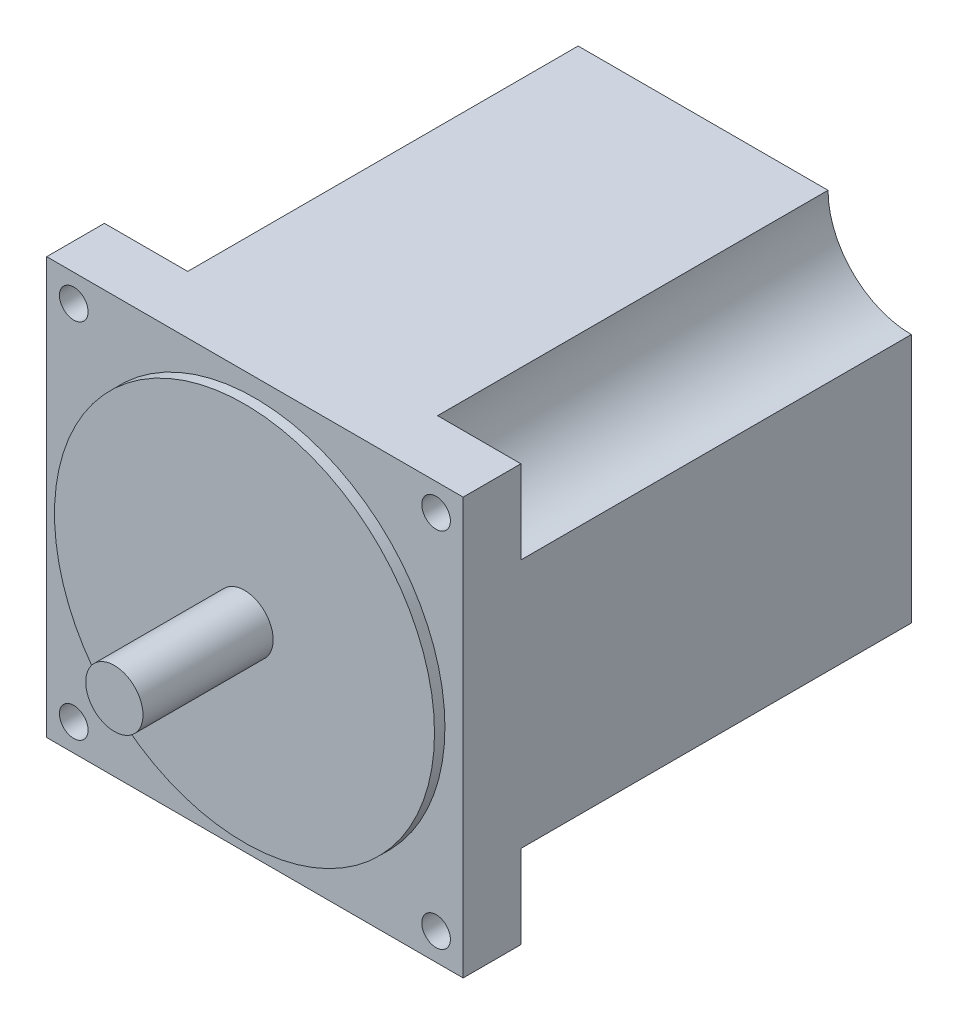
from build123d import *

# Parameters (mm, degrees)
SKETCH2_W           = 80
SKETCH2_H           = 80
BOSS_EXTRUDE1_DEPTH = 86.09
SKETCH3_R           = 2.75
CUT_EXTRUDE1_DEPTH  = 104.012077447
SKETCH4_R           = 36.5
BOSS_EXTRUDE2_DEPTH = 2
SKETCH5_R           = 5.5
BOSS_EXTRUDE3_DEPTH = 25
CUT_EXTRUDE2_START  = -75
SKETCH6_R           = 2.75
CUT_EXTRUDE2_DEPTH  = 75
SKETCH7_R           = 4.006
BOSS_EXTRUDE4_DEPTH = 13.5


with BuildPart() as part:
    # Sketch2 → Boss-Extrude1 (new body)
    with BuildSketch(Plane.XY):
        Rectangle(SKETCH2_W, SKETCH2_H)
    extrude(amount=BOSS_EXTRUDE1_DEPTH)

    # Sketch3 → Cut-Extrude1 (cut, through all)
    with BuildSketch(Plane.XY.offset(86.09)):
        with Locations((-34.8, 34.8)):
            Circle(SKETCH3_R)
        with Locations((34.8, 34.8)):
            Circle(SKETCH3_R)
        with Locations((-34.8, -34.8)):
            Circle(SKETCH3_R)
        with Locations((34.8, -34.8)):
            Circle(SKETCH3_R)
    extrude(amount=-CUT_EXTRUDE1_DEPTH, mode=Mode.SUBTRACT)

    # Sketch4 → Boss-Extrude2 (add)
    with BuildSketch(Plane.XY.offset(86.09)):
        Circle(SKETCH4_R)
    extrude(amount=BOSS_EXTRUDE2_DEPTH)

    # Sketch5 → Boss-Extrude3 (add)
    with BuildSketch(Plane.XY.offset(88.09)):
        Circle(SKETCH5_R)
    extrude(amount=BOSS_EXTRUDE3_DEPTH)

    # Sketch6 → Cut-Extrude2 (cut)
    # profile 1 of 4: a face of its own
    with BuildSketch(Plane(origin=(0, 0, 0), x_dir=(-1, 0, 0), z_dir=(0, 0, -1)).offset(CUT_EXTRUDE2_START)):
        with BuildLine():
            Line((24, -40), (40, -40))
            Line((40, -40), (40, -24))
            ThreePointArc((40, -24), (28.686291501, -28.686291501), (24, -40))
        make_face()
        with Locations((34.8, -34.8)):
            Circle(SKETCH6_R, mode=Mode.SUBTRACT)
    # profile 2 of 4: a face of its own
    with BuildSketch(Plane(origin=(0, 0, 0), x_dir=(-1, 0, 0), z_dir=(0, 0, -1)).offset(CUT_EXTRUDE2_START)):
        with BuildLine():
            Line((-40, -40), (-24, -40))
            ThreePointArc((-24, -40), (-28.686291501, -28.686291501), (-40, -24))
            Line((-40, -24), (-40, -40))
        make_face()
        with Locations((-34.8, -34.8)):
            Circle(SKETCH6_R, mode=Mode.SUBTRACT)
    # profile 3 of 4: a face of its own
    with BuildSketch(Plane(origin=(0, 0, 0), x_dir=(-1, 0, 0), z_dir=(0, 0, -1)).offset(CUT_EXTRUDE2_START)):
        with BuildLine():
            ThreePointArc((24, 40), (28.686291501, 28.686291501), (40, 24))
            Line((40, 24), (40, 40))
            Line((40, 40), (24, 40))
        make_face()
        with Locations((34.8, 34.8)):
            Circle(SKETCH6_R, mode=Mode.SUBTRACT)
    # profile 4 of 4: a face of its own
    with BuildSketch(Plane(origin=(0, 0, 0), x_dir=(-1, 0, 0), z_dir=(0, 0, -1)).offset(CUT_EXTRUDE2_START)):
        with BuildLine():
            Line((-40, 40), (-40, 24))
            ThreePointArc((-40, 24), (-28.686291501, 28.686291501), (-24, 40))
            Line((-24, 40), (-40, 40))
        make_face()
        with Locations((-34.8, 34.8)):
            Circle(SKETCH6_R, mode=Mode.SUBTRACT)
    extrude(amount=CUT_EXTRUDE2_DEPTH, mode=Mode.SUBTRACT)

    # Sketch7 → Boss-Extrude4 (add)
    with BuildSketch(Plane(origin=(0, 0, 0), x_dir=(-1, 0, 0), z_dir=(0, 0, -1))):
        Circle(SKETCH7_R)
    extrude(amount=BOSS_EXTRUDE4_DEPTH)


solid = part.part
